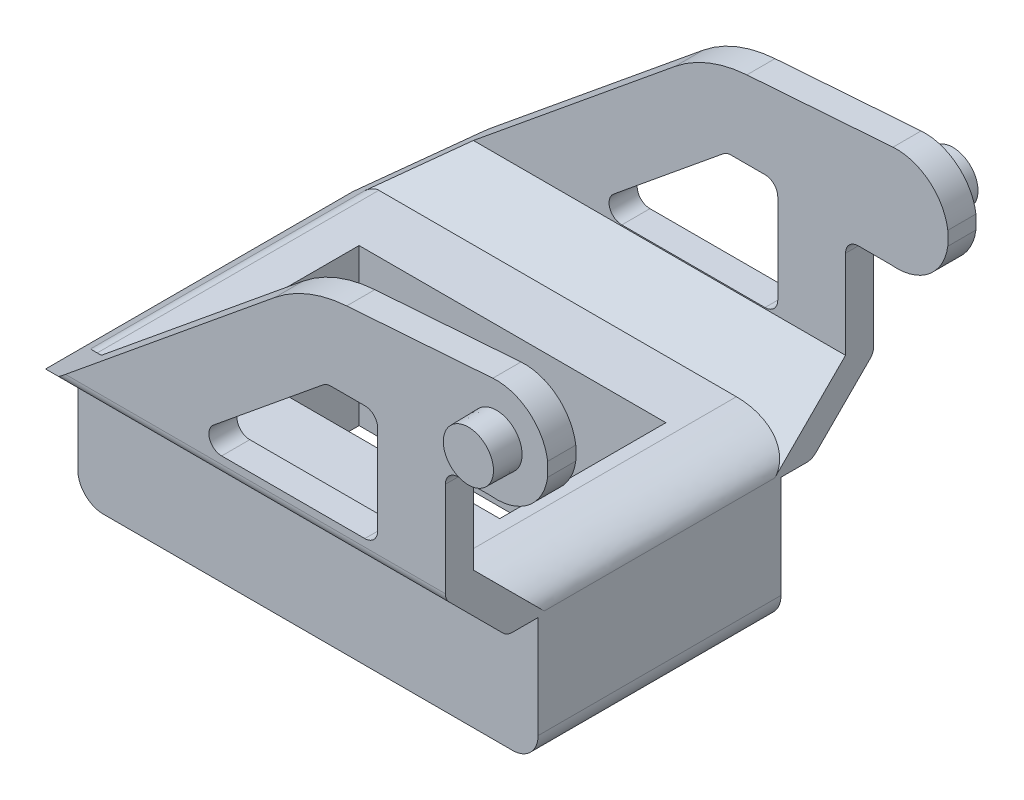
from build123d import *

# Parameters (mm, degrees)
SKETCH1_W           = 36
SKETCH1_H           = 19
BOSS_EXTRUDE1_DEPTH = 10
SKETCH2_W           = 24
SKETCH2_H           = 13
CUT_EXTRUDE1_DEPTH  = 10
SKETCH3_W           = 44
SKETCH3_H           = 33.5
BOSS_EXTRUDE2_DEPTH = 22
CUT_EXTRUDE2_REACH  = 58.926
CUT_EXTRUDE3_REACH  = 58.926
CUT_EXTRUDE4_DEPTH  = 54.124852941
CUT_EXTRUDE6_DEPTH  = 54.124852941
CUT_EXTRUDE7_DEPTH  = 54.124852941
SKETCH12_R          = 2
BOSS_EXTRUDE3_DEPTH = 2.2
BOSS_EXTRUDE3_TAPER = 1
CUT_EXTRUDE8_REACH  = 40.809
SKETCH13_W          = 24
SKETCH13_H          = 13
FILLET1_R           = 2
FILLET2_R           = 1
FILLET4_SIZE        = 2
FILLET4_SIZE_2      = 5
FILLET5_R           = 1.3


with BuildPart() as part:
    # Sketch1 → Boss-Extrude1 (new body)
    with BuildSketch(Plane(origin=(0, 0, 0), x_dir=(1, 0, 0), z_dir=(0, 1, 0))):
        Rectangle(SKETCH1_W, SKETCH1_H)
    extrude(amount=BOSS_EXTRUDE1_DEPTH)

    # Sketch2 → Cut-Extrude1 (cut)
    with BuildSketch(Plane(origin=(0, 10, 0), x_dir=(1, 0, 0), z_dir=(0, 1, 0))):
        Rectangle(SKETCH2_W, SKETCH2_H)
    extrude(amount=-CUT_EXTRUDE1_DEPTH, mode=Mode.SUBTRACT)

    # Sketch3 → Boss-Extrude2 (add)
    with BuildSketch(Plane(origin=(0, 10, 0), x_dir=(1, 0, 0), z_dir=(0, 1, 0))):
        with Locations((4, 0)):
            Rectangle(SKETCH3_W, SKETCH3_H)
    extrude(amount=BOSS_EXTRUDE2_DEPTH)

    # Sketch5 → Cut-Extrude2 (cut, up to next)
    with BuildSketch(Plane.ZY.offset(18), mode=Mode.PRIVATE) as cut_extrude2_sk1:
        Polygon((-14.55, 32), (14.55, 32), (14.55, 15.735533906), (11.014466094, 12.2), (-11.014466094, 12.2), (-14.55, 15.735533906), align=None)
    cut_extrude2_tool1 = extrude(cut_extrude2_sk1.sketch, amount=-CUT_EXTRUDE2_REACH, mode=Mode.PRIVATE) & part.part
    add(cut_extrude2_tool1.solids().sort_by_distance((-18, 22.293405, 0))[0], mode=Mode.SUBTRACT)

    # Sketch7 → Cut-Extrude3 (cut, up to next)
    with BuildSketch(Plane.ZY.offset(18), mode=Mode.PRIVATE) as cut_extrude3_sk1:
        Polygon((-16.75, 14.824264069), (-11.925735931, 10), (-16.75, 10), align=None)
    cut_extrude3_tool1 = extrude(cut_extrude3_sk1.sketch, amount=-CUT_EXTRUDE3_REACH, mode=Mode.PRIVATE) & part.part
    # Sketch7 → Cut-Extrude3 (cut, up to next)
    with BuildSketch(Plane.ZY.offset(18), mode=Mode.PRIVATE) as cut_extrude3_sk2:
        Polygon((16.75, 14.824264069), (11.925735931, 10), (16.75, 10), align=None)
    cut_extrude3_tool2 = extrude(cut_extrude3_sk2.sketch, amount=-CUT_EXTRUDE3_REACH, mode=Mode.PRIVATE) & part.part
    add(cut_extrude3_tool1.solids().sort_by_distance((-18, 11.608088, -15.141912))[0], mode=Mode.SUBTRACT)
    add(cut_extrude3_tool2.solids().sort_by_distance((-18, 11.608088, 15.141912))[0], mode=Mode.SUBTRACT)

    # Sketch9 → Cut-Extrude4 (cut, through all)
    with BuildSketch(Plane.XY.offset(16.75)):
        with BuildLine():
            Line((12.7, 23.824264069), (12.7, 16.824264069))
            ThreePointArc((12.7, 16.824264069), (12.407106781, 16.117157288), (11.7, 15.824264069))
            Line((11.7, 15.824264069), (0.501407823, 15.824264069))
            ThreePointArc((0.501407823, 15.824264069), (-0.440387617, 16.488077587), (-0.131829968, 17.598221368))
            Line((-0.131829968, 17.598221368), (8.423725588, 24.598221368))
            ThreePointArc((8.423725588, 24.598221368), (8.720776897, 24.766059508), (9.056963378, 24.824264069))
            Line((9.056963378, 24.824264069), (11.7, 24.824264069))
            ThreePointArc((11.7, 24.824264069), (12.407106781, 24.53137085), (12.7, 23.824264069))
        make_face()
    extrude(amount=-CUT_EXTRUDE4_DEPTH, mode=Mode.SUBTRACT)

    # Sketch10 → Cut-Extrude6 (cut, through all)
    with BuildSketch(Plane.XY.offset(16.75)):
        with BuildLine():
            Line((-18, 10.098548576), (4.662823879, 28.640859022))
            ThreePointArc((4.662823879, 28.640859022), (7.299328616, 30.193246078), (10.281806361, 30.875806919))
            Line((10.281806361, 30.875806919), (26, 32))
            Line((26, 32), (-18, 32))
            Line((-18, 32), (-18, 10.098548576))
        make_face()
    extrude(amount=-CUT_EXTRUDE6_DEPTH, mode=Mode.SUBTRACT)

    # Sketch11 → Cut-Extrude7 (cut, through all)
    with BuildSketch(Plane.XY.offset(16.75)):
        with BuildLine():
            Line((18, 10), (18, 22.653857453))
            ThreePointArc((18, 22.653857453), (18.292893219, 23.360964234), (19, 23.653857453))
            Line((19, 23.653857453), (21.567861559, 23.653857453))
            ThreePointArc((21.567861559, 23.653857453), (26.035822704, 27.594752604), (21.71203996, 31.693317495))
            Line((21.71203996, 31.693317495), (18, 31.427825814))
            Line((18, 31.427825814), (18, 34.061365202))
            Line((18, 34.061365202), (30.208332635, 34.9345268))
            Line((30.208332635, 34.9345268), (29.247958423, 10))
            Line((29.247958423, 10), (18, 10))
        make_face()
    extrude(amount=-CUT_EXTRUDE7_DEPTH, mode=Mode.SUBTRACT)

    # Sketch12 → Boss-Extrude3 (add)
    with BuildSketch(Plane.XY.offset(16.75)):
        with Locations((22, 27.667130408)):
            Circle(SKETCH12_R)
    boss_extrude3 = extrude(amount=BOSS_EXTRUDE3_DEPTH, taper=BOSS_EXTRUDE3_TAPER)

    # Mirror1: Boss-Extrude3 across plane
    add(boss_extrude3.mirror(Plane.XY))

    # Sketch13 → Cut-Extrude8 (cut, up to next)
    with BuildSketch(Plane.XZ.offset(-10), mode=Mode.PRIVATE) as cut_extrude8_sk1:
        Rectangle(SKETCH13_W, SKETCH13_H)
    cut_extrude8_tool1 = extrude(cut_extrude8_sk1.sketch, amount=-CUT_EXTRUDE8_REACH, mode=Mode.PRIVATE) & part.part
    add(cut_extrude8_tool1.solids().sort_by_distance((0, 10, 0))[0], mode=Mode.SUBTRACT)

    # Fillet1
    fillet1_edges = [part.edges().sort_by_distance(p)[0] for p in [
        (-18, 0, 0),
        (18, 0, 0),
    ]]
    fillet(fillet1_edges, radius=FILLET1_R)

    # Fillet2
    fillet2_edges = [part.edges().sort_by_distance(p)[0] for p in [
        (2.887937246, 14.824264069, -16.75),
        (2.887937246, 14.824264069, 16.75),
        (0, 10, -11.925735931),
        (0, 10, 11.925735931),
    ]]
    fillet(fillet2_edges, radius=FILLET2_R)

    # Fillet4
    # a fillet whose section is not a circle: 5, 2 mm, written as the material it takes off along each edge
    with BuildSketch(Plane(origin=(18, 12.2, 23.514466094), x_dir=(0, -1, 0), z_dir=(0, 0, -1))) as fillet4_piece_1_section:
        with BuildLine():
            Bezier((FILLET4_SIZE, 0), (0, 0), (0, FILLET4_SIZE_2), weights=[1, 0.707106781, 1])
            Line((0, FILLET4_SIZE_2), (0, 0))
            Line((0, 0), (FILLET4_SIZE, 0))
        make_face()
    fillet4_piece_1 = extrude(amount=47.028932188, mode=Mode.PRIVATE)
    fillet4_piece_1 = split(fillet4_piece_1, bisect_by=Plane(origin=(18, 18.45, 17.264466094), z_dir=(0, 0.7071067811865465, -0.7071067811865486)), keep=Keep.TOP, mode=Mode.PRIVATE)
    fillet4_piece_1 = split(fillet4_piece_1, bisect_by=Plane(origin=(18, -5.064466094, 6.25), z_dir=(0, 0.7071067811865478, 0.7071067811865474)), keep=Keep.TOP, mode=Mode.PRIVATE)
    add(fillet4_piece_1, mode=Mode.SUBTRACT)

    # Fillet5
    fillet5_edges = [part.edges().sort_by_distance(p)[0] for p in [
        (-15.43155937, 12.2, 0),
    ]]
    fillet(fillet5_edges, radius=FILLET5_R)


solid = part.part
